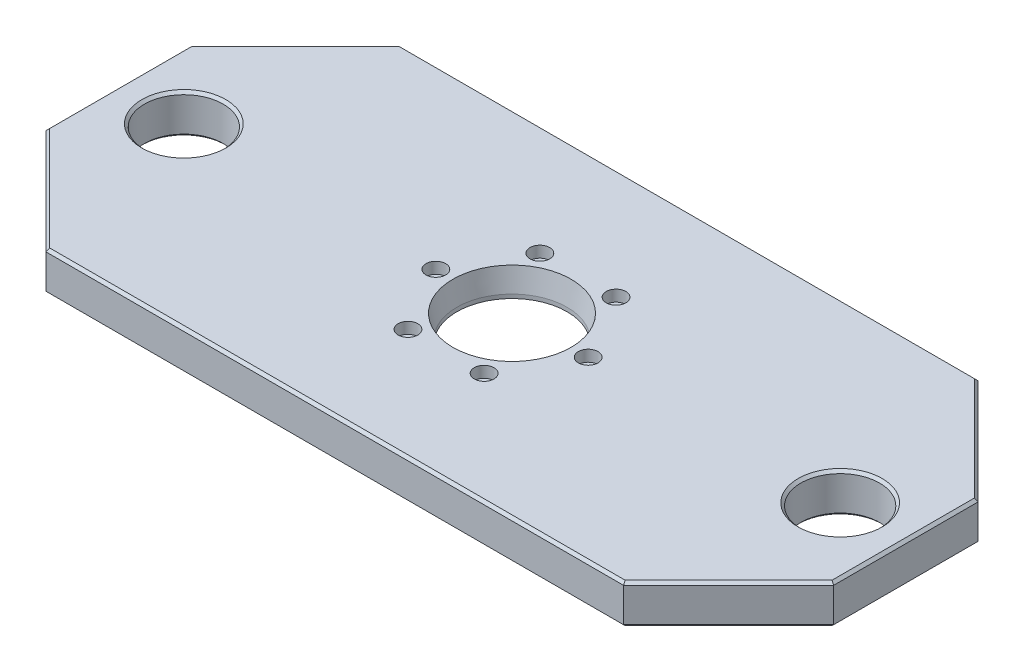
from build123d import *

# Parameters (mm, degrees)
WYCI_GNI_CIE1_DEPTH                                 = 30
WYCI_GNI_CIE2_REACH                                 = 332.341
SZKIC3_R                                            = 30
SFAZOWANIE1_SIZE                                    = 2
OTW_R2_OUTLINE_R                                    = 42
OTW_R2_DEPTH                                        = 12.986154641
OTW_R3_OUTLINE_R                                    = 70
OTW_R3_OUTLINE_R_2                                  = 42
OTW_R3_DEPTH                                        = 10
POG_BIENIE_WALCOWE_POD_M8_WKR_T_Z_BEM_W_D           = 9
POG_BIENIE_WALCOWE_POD_M8_WKR_T_Z_BEM_W_CBORE_D     = 15
POG_BIENIE_WALCOWE_POD_M8_WKR_T_Z_BEM_W_CBORE_DEPTH = 8.6


# Read off the part's stored shape, not the designer's step: Otwór2, Otwór3
with BuildPart() as part:
    # Szkic1 → Wyciągnięcie1 (new body)
    with BuildSketch(Plane(origin=(0, 0, 0), x_dir=(1, 0, 0), z_dir=(0, 1, 0))):
        Polygon((-220, -135), (220, -135), (300, -55), (300, 55), (220, 135), (-220, 135), (-300, 55), (-300, -55), align=None)
    extrude(amount=WYCI_GNI_CIE1_DEPTH)

    # Szkic3 → Wyciągnięcie2 (cut, up to next)
    with BuildSketch(Plane(origin=(0, 30, 0), x_dir=(1, 0, 0), z_dir=(0, 1, 0)), mode=Mode.PRIVATE) as wyci_gni_cie2_sk1:
        with Locations(Location((-250, 0, 0), (0, 0, 270))):
            Circle(SZKIC3_R)
    wyci_gni_cie2_tool1 = extrude(wyci_gni_cie2_sk1.sketch, amount=-WYCI_GNI_CIE2_REACH, mode=Mode.PRIVATE) & part.part
    # Szkic3 → Wyciągnięcie2 (cut, up to next)
    with BuildSketch(Plane(origin=(0, 30, 0), x_dir=(1, 0, 0), z_dir=(0, 1, 0)), mode=Mode.PRIVATE) as wyci_gni_cie2_sk2:
        with Locations(Location((250, 0, 0), (0, 0, 270))):
            Circle(SZKIC3_R)
    wyci_gni_cie2_tool2 = extrude(wyci_gni_cie2_sk2.sketch, amount=-WYCI_GNI_CIE2_REACH, mode=Mode.PRIVATE) & part.part
    add(wyci_gni_cie2_tool1.solids().sort_by_distance((-250, 30, 0))[0], mode=Mode.SUBTRACT)
    add(wyci_gni_cie2_tool2.solids().sort_by_distance((250, 30, 0))[0], mode=Mode.SUBTRACT)

    # Sfazowanie1
    sfazowanie1_edges = [part.edges().sort_by_distance(p)[0] for p in [
        (-260, 30, 95),
        (-300, 0, 0),
        (-260, 0, -95),
        (0, 30, 135),
        (260, 30, 95),
        (300, 30, 0),
        (260, 30, -95),
        (-250, 30, -30),
        (-250, 0, -30),
        (0, 30, -135),
        (250, 30, -30),
        (250, 0, -30),
        (-260, 30, -95),
        (-300, 30, 0),
        (0, 0, -135),
        (260, 0, -95),
        (300, 0, 0),
        (260, 0, 95),
        (0, 0, 135),
        (-260, 0, 95),
    ]]
    chamfer(sfazowanie1_edges, length=SFAZOWANIE1_SIZE)

    # Szkic6 → Otwór1 (revolve, cut)
    with BuildSketch(Plane(origin=(0, 30, 0), x_dir=(0, 0, 1), z_dir=(1, 0, 0))):
        Polygon((0, 0), (0, 30), (10, 30), (10, 198.494863687), (45, 0), align=None)
    revolve(axis=Axis((0, 36.445314094, 0), (0, -1, 0)), mode=Mode.SUBTRACT)

    # Otwór2 outline → Otwór2 (cut)
    with BuildSketch(Plane(origin=(0, 0, 0), x_dir=(1, 0, 0), z_dir=(0, 1, 0))):
        Circle(OTW_R2_OUTLINE_R)
    extrude(amount=OTW_R2_DEPTH, mode=Mode.SUBTRACT)

    # Otwór3 outline → Otwór3 (cut)
    with BuildSketch(Plane(origin=(0, 0, 0), x_dir=(1, 0, 0), z_dir=(0, 1, 0))):
        Circle(OTW_R3_OUTLINE_R)
        Circle(OTW_R3_OUTLINE_R_2, mode=Mode.SUBTRACT)
    extrude(amount=OTW_R3_DEPTH, mode=Mode.SUBTRACT)

    # Pogłębienie walcowe pod M8 Wkręt z łbem walcowym z gniazdem sześciokątnym1 (through all)
    with Locations(Plane(origin=(0, 30, 0), x_dir=(1, 0, 0), z_dir=(0, 1, 0))):
        with Locations((-58.015165068, 0), (-29.007582534, 50.242606754), (29.007582534, 50.242606754), (58.015165068, 0), (29.007582534, -50.242606754), (-29.007582534, -50.242606754)):
            CounterBoreHole(POG_BIENIE_WALCOWE_POD_M8_WKR_T_Z_BEM_W_D / 2, POG_BIENIE_WALCOWE_POD_M8_WKR_T_Z_BEM_W_CBORE_D / 2, POG_BIENIE_WALCOWE_POD_M8_WKR_T_Z_BEM_W_CBORE_DEPTH)


solid = part.part
